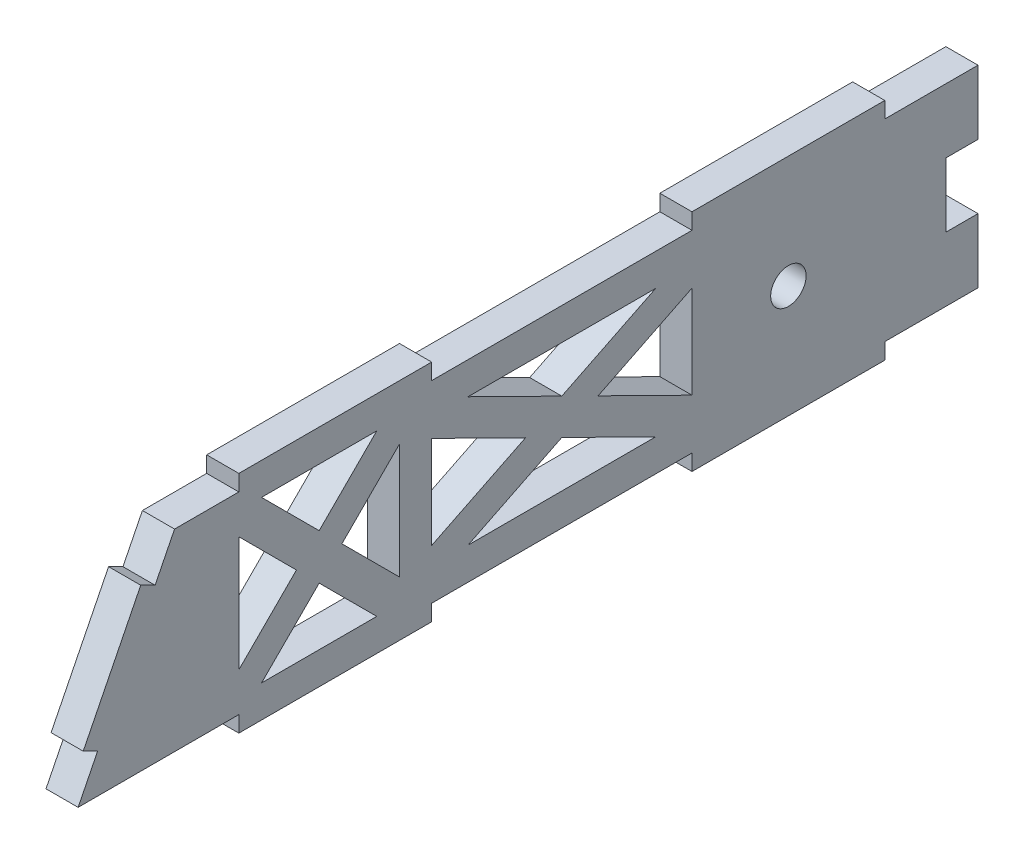
from build123d import *

# Parameters (mm, degrees)
SKETCH1_W               = 355.6
SKETCH1_H               = 76.2
BOSS_EXTRUDE1_DEPTH     = 12.7
CUT_EXTRUDE1_DEPTH      = 183.279291199
CUT_EXTRUDE1_DEPTH_BACK = 183.279291199
SKETCH3_W               = 76.2
SKETCH3_H               = 6.35
BOSS_EXTRUDE2_DEPTH     = 12.7
SKETCH4_W               = 12.7
SKETCH4_H               = 25.4
CUT_EXTRUDE2_DEPTH      = 184.711546997
SKETCH5_R               = 7
CUT_EXTRUDE3_DEPTH      = 184.711546997
CUT_EXTRUDE4_DEPTH      = 184.711546997
BOSS_EXTRUDE3_DEPTH     = 12.7


with BuildPart() as part:
    # Sketch1 → Boss-Extrude1 (new body)
    with BuildSketch(Plane(origin=(0, 0, 0), x_dir=(0, 0, -1), z_dir=(1, 0, 0))):
        Rectangle(SKETCH1_W, SKETCH1_H)
    extrude(amount=BOSS_EXTRUDE1_DEPTH)

    # Sketch2 → Cut-Extrude1 (cut, two sides: drawn at the far end of the back side and taken through both)
    with BuildSketch(Plane(origin=(12.7, 0, 0), x_dir=(0, 0, -1), z_dir=(1, 0, 0)).offset(-CUT_EXTRUDE1_DEPTH_BACK)):
        Polygon((-507.550847217, -697.601694433), (-177.8, -38.1), (-139.7, 38.1), (190.050847217, 697.601694433), (-1128.95254165, 1357.103388866), (-1826.554236083, -38.1), align=None)
    extrude(amount=CUT_EXTRUDE1_DEPTH + CUT_EXTRUDE1_DEPTH_BACK, mode=Mode.SUBTRACT)

    # Sketch3 → Boss-Extrude2 (add)
    with BuildSketch(Plane.ZY):
        with Locations((-102.87, -41.275)):
            Rectangle(SKETCH3_W, SKETCH3_H)
        with Locations((76.2, -41.275)):
            Rectangle(SKETCH3_W, SKETCH3_H)
        with Locations((-102.87, 41.275)):
            Rectangle(SKETCH3_W, SKETCH3_H)
        with Locations((76.2, 41.275)):
            Rectangle(SKETCH3_W, SKETCH3_H)
    extrude(amount=-BOSS_EXTRUDE2_DEPTH)

    # Sketch4 → Cut-Extrude2 (cut, through all)
    with BuildSketch(Plane.ZY):
        with Locations((-171.45, 0)):
            Rectangle(SKETCH4_W, SKETCH4_H)
    extrude(amount=-CUT_EXTRUDE2_DEPTH, mode=Mode.SUBTRACT)

    # Sketch5 → Cut-Extrude3 (cut, through all)
    with BuildSketch(Plane.ZY):
        with Locations((-102.87, 0)):
            Circle(SKETCH5_R)
    extrude(amount=-CUT_EXTRUDE3_DEPTH, mode=Mode.SUBTRACT)

    # Sketch6 → Cut-Extrude4 (cut, through all)
    with BuildSketch(Plane.ZY):
        Polygon((23.758802297, 25.4), (-50.428802297, 25.4), (-13.335, 7.08207294), align=None)
        Polygon((-27.676197703, 0), (-64.77, 18.31792706), (-64.77, -18.31792706), align=None)
        Polygon((38.1, -18.31792706), (38.1, 18.31792706), (1.006197703, 0), align=None)
        Polygon((-13.335, -7.08207294), (-50.428802297, -25.4), (23.758802297, -25.4), align=None)
        Polygon((105.319743879, 31.75), (59.780256121, 31.75), (82.55, 8.980256121), align=None)
        Polygon((73.569743879, 0), (50.8, 22.769743879), (50.8, -22.769743879), align=None)
        Polygon((114.3, 22.769743879), (91.530256121, 0), (114.3, -22.769743879), align=None)
        Polygon((105.319743879, -31.75), (82.55, -8.980256121), (59.780256121, -31.75), align=None)
    extrude(amount=-CUT_EXTRUDE4_DEPTH, mode=Mode.SUBTRACT)

    # Sketch8 → Boss-Extrude3 (add)
    with BuildSketch(Plane(origin=(12.7, 0, 0), x_dir=(0, 0, -1), z_dir=(1, 0, 0))):
        Polygon((-147.390774674, 22.718450651), (-170.109225326, -22.718450651), (-175.788837989, -19.87864432), (-153.070387337, 25.558256983), align=None)
    extrude(amount=-BOSS_EXTRUDE3_DEPTH)


solid = part.part
